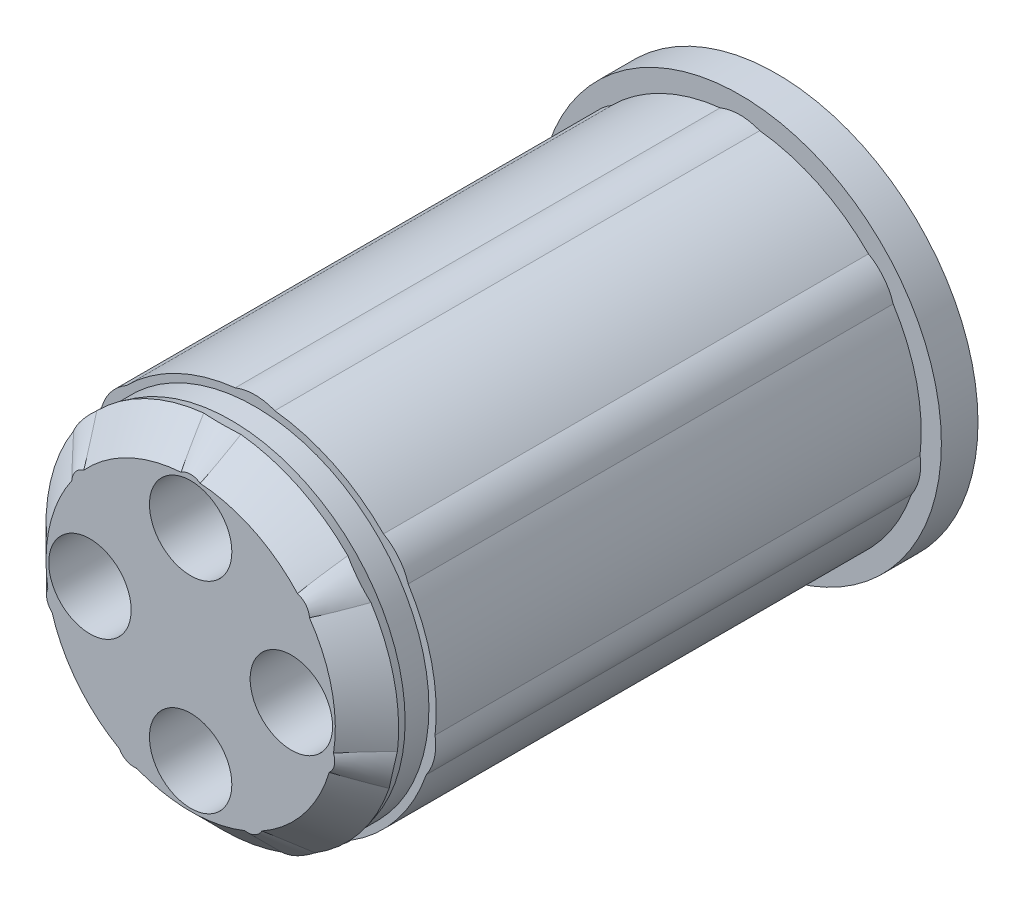
from build123d import *

# Parameters (mm, degrees)
AUFSATZ_LINEAR_AUSTRAGEN1_DEPTH      = 32
SKIZZE2_R                            = 11
AUFSATZ_LINEAR_AUSTRAGEN2_DEPTH      = 2
FASE1_SIZE                           = 2
SCHNITT_LINEAR_AUSTRAGEN1_DEPTH      = 34.793490586
SCHNITT_LINEAR_AUSTRAGEN1_DEPTH_BACK = 34.793490586
SKIZZE3_R                            = 2.25


with BuildPart() as part:
    # Skizze1 → Aufsatz-Linear austragen1 (new body)
    with BuildSketch(Plane.XY):
        with BuildLine():
            ThreePointArc((9.834694469, -1.13524654), (9.651786331, 2.202957246), (8.368188528, 5.289935799))
            ThreePointArc((8.368188528, 5.289935799), (7.857406399, 6.266072509), (7.019403191, 6.981259116))
            ThreePointArc((7.019403191, 6.981259116), (4.295449017, 8.919591792), (1.081641859, 9.840734266))
            ThreePointArc((1.081641859, 9.840734266), (0, 10.05), (-1.081641859, 9.840734266))
            ThreePointArc((-1.081641859, 9.840734266), (-4.295449017, 8.919591792), (-7.019403191, 6.981259116))
            ThreePointArc((-7.019403191, 6.981259116), (-7.857406399, 6.266072509), (-8.368188528, 5.289935799))
            ThreePointArc((-8.368188528, 5.289935799), (-9.651786331, 2.202957246), (-9.834694469, -1.13524654))
            ThreePointArc((-9.834694469, -1.13524654), (-9.798025517, -2.236335386), (-9.353318555, -3.244292219))
            ThreePointArc((-9.353318555, -3.244292219), (-7.740131676, -6.172549038), (-5.24426022, -8.396888397))
            ThreePointArc((-5.24426022, -8.396888397), (-4.360531578, -9.054737122), (-3.295208938, -9.335502025))
            ThreePointArc((-3.295208938, -9.335502025), (0, -9.9), (3.295208938, -9.335502025))
            ThreePointArc((3.295208938, -9.335502025), (4.360531578, -9.054737122), (5.24426022, -8.396888397))
            ThreePointArc((5.24426022, -8.396888397), (7.740131676, -6.172549038), (9.353318555, -3.244292219))
            ThreePointArc((9.353318555, -3.244292219), (9.798025517, -2.236335386), (9.834694469, -1.13524654))
        make_face()
    extrude(amount=AUFSATZ_LINEAR_AUSTRAGEN1_DEPTH)

    # Skizze2 → Aufsatz-Linear austragen2 (add)
    with BuildSketch(Plane.XY):
        Circle(SKIZZE2_R)
    extrude(amount=AUFSATZ_LINEAR_AUSTRAGEN2_DEPTH)

    # Fase1
    fase1_edges = [part.edges().sort_by_distance(p)[0] for p in [
        (9.798025517, -2.236335386, 32),
        (7.740131676, -6.172549038, 32),
        (4.360531578, -9.054737122, 32),
        (0, -9.9, 32),
        (-4.360531578, -9.054737122, 32),
        (-7.740131676, -6.172549038, 32),
        (-9.798025517, -2.236335386, 32),
        (-9.651786331, 2.202957246, 32),
        (-7.857406399, 6.266072509, 32),
        (-4.295449017, 8.919591792, 32),
        (0, 10.05, 32),
        (4.295449017, 8.919591792, 32),
        (7.857406399, 6.266072509, 32),
        (9.651786331, 2.202957246, 32),
    ]]
    chamfer(fase1_edges, length=FASE1_SIZE)

    # Skizze3 → Schnitt-Linear austragen1 (cut, two sides: drawn at the far end of the back side and taken through both)
    with BuildSketch(Plane.XY.offset(2).offset(-SCHNITT_LINEAR_AUSTRAGEN1_DEPTH_BACK)):
        with Locations((0, 5.5)):
            Circle(SKIZZE3_R)
        with Locations((5.5, 0)):
            Circle(SKIZZE3_R)
        with Locations((0, -5.5)):
            Circle(SKIZZE3_R)
        with Locations((-5.5, 0)):
            Circle(SKIZZE3_R)
    extrude(amount=SCHNITT_LINEAR_AUSTRAGEN1_DEPTH + SCHNITT_LINEAR_AUSTRAGEN1_DEPTH_BACK, mode=Mode.SUBTRACT)

    # Skizze4 → Schnitt-Rotation1 (revolve, cut)
    with BuildSketch(Plane(origin=(0, 0, 0), x_dir=(0, 0, -1), z_dir=(1, 0, 0))):
        Polygon((-29.78614629, 10.05), (-28.48614629, 10.05), (-28.48614629, 9.5), (-29.78614629, 9.5), (-31.838774234, 10.05), align=None)
    revolve(axis=Axis((0, 0, 0), (0, 0, -1)), mode=Mode.SUBTRACT)


solid = part.part
